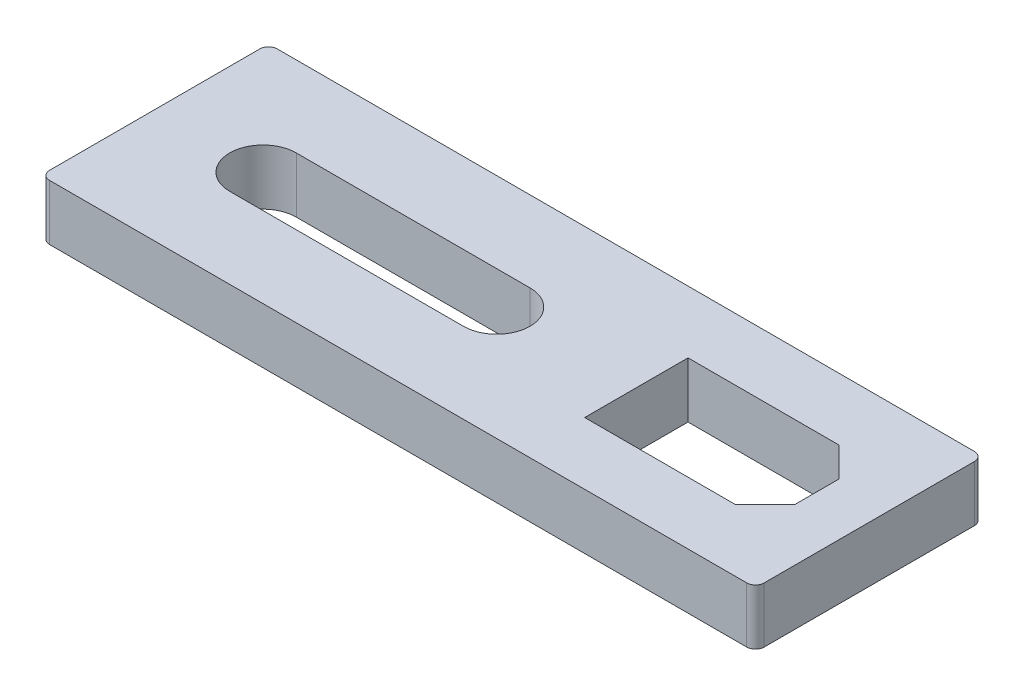
from build123d import *

# Parameters (mm, degrees)
SKETCH1_W           = 40.8
SKETCH1_H           = 13
BOSS_EXTRUDE1_DEPTH = 3.175
FILLET1_R           = 0.5


with BuildPart() as part:
    # Sketch1 → Boss-Extrude1 (new body)
    with BuildSketch(Plane(origin=(0, 0, 0), x_dir=(1, 0, 0), z_dir=(0, 1, 0))):
        with Locations((20.4, 6.5)):
            Rectangle(SKETCH1_W, SKETCH1_H)
        Polygon((37.8, 5.229289322), (37.8, 7.770710678), (36.120710678, 9.45), (27.5, 9.45), (27.5, 3.55), (36.120710678, 3.55), align=None, mode=Mode.SUBTRACT)
        with BuildLine():
            Line((6.183400571, 8.4), (19.527589466, 8.4))
            ThreePointArc((19.527589466, 8.4), (21.427589466, 6.5), (19.527589466, 4.6))
            Line((19.527589466, 4.6), (6.183400571, 4.6))
            ThreePointArc((6.183400571, 4.6), (4.283400571, 6.5), (6.183400571, 8.4))
        make_face(mode=Mode.SUBTRACT)
    extrude(amount=BOSS_EXTRUDE1_DEPTH)

    # Fillet1
    fillet1_edges = [part.edges().sort_by_distance(p)[0] for p in [
        (40.8, 1.5875, -13),
        (40.8, 1.5875, 0),
        (0, 1.5875, -13),
        (0, 1.5875, 0),
    ]]
    fillet(fillet1_edges, radius=FILLET1_R)


solid = part.part
